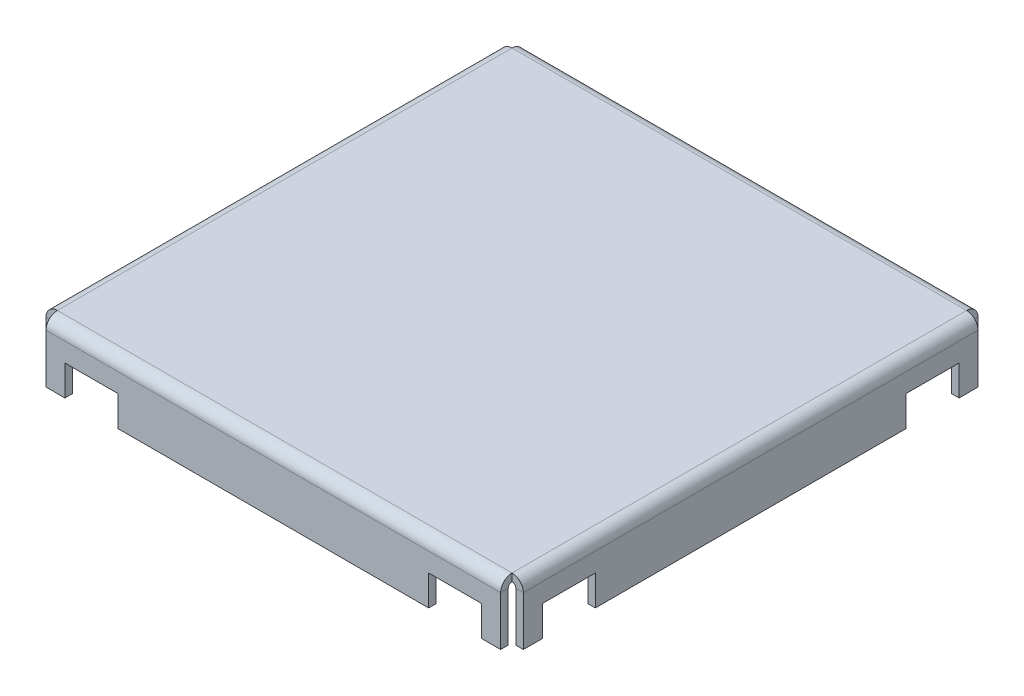
from build123d import *

# Parameters (mm, degrees)
BASES_W             = 12
BASES_H             = 12
BASE_DEPTH          = 0.2
EDGE_FLANGE1_DEPTH  = 12
EDGE_FLANGE2_DEPTH  = 12
EDGE_FLANGE3_DEPTH  = 12
EDGE_FLANGE4_DEPTH  = 12
VENTS_W             = 1.4
VENTS_H             = 0.8
VENT_DEPTH          = 10.052071586
VCP_COUNT           = 2
VCP_ANGLE           = 90
VCP_COPY_1_SKETCH_W = 1.4
VCP_COPY_1_SKETCH_H = 0.8
VCP_COPY_1_DEPTH    = 10.052071586


# Sheet-metal steps are written as plain solids
with BuildPart() as part:
    # BaseS → Base (new body)
    with BuildSketch(Plane(origin=(0, 1.6, 0), x_dir=(1, 0, 0), z_dir=(0, 1, 0))):
        Rectangle(BASES_W, BASES_H)
    extrude(amount=-BASE_DEPTH)

    # Edge-Flange1 section (across the edge) → Edge-Flange1 (add)
    with BuildSketch(Plane(origin=(6, 1.4, 6.1), x_dir=(0, 0, -1), z_dir=(-1, 0, 0))):
        with BuildLine():
            Line((-0.2, 0.1), (-0.2, 1.4))
            Line((-0.2, 1.4), (0, 1.4))
            Line((0, 1.4), (0, 0.1))
            ThreePointArc((0, 0.1), (0.029289322, 0.029289322), (0.1, 0))
            Line((0.1, 0), (0.1, -0.2))
            ThreePointArc((0.1, -0.2), (-0.112132034, -0.112132034), (-0.2, 0.1))
        make_face()
    extrude(amount=EDGE_FLANGE1_DEPTH)

    # Edge-Flange2 section (across the edge) → Edge-Flange2 (add)
    with BuildSketch(Plane(origin=(-6, 1.4, -6.1), x_dir=(0, 0, 1), z_dir=(1, 0, 0))):
        with BuildLine():
            Line((-0.2, 0.1), (-0.2, 1.4))
            Line((-0.2, 1.4), (0, 1.4))
            Line((0, 1.4), (0, 0.1))
            ThreePointArc((0, 0.1), (0.029289322, 0.029289322), (0.1, 0))
            Line((0.1, 0), (0.1, -0.2))
            ThreePointArc((0.1, -0.2), (-0.112132034, -0.112132034), (-0.2, 0.1))
        make_face()
    extrude(amount=EDGE_FLANGE2_DEPTH)

    # Edge-Flange3 section (across the edge) → Edge-Flange3 (add)
    with BuildSketch(Plane(origin=(6.1, 1.4, -6), x_dir=(-1, 0, 0), z_dir=(0, 0, 1))):
        with BuildLine():
            Line((-0.2, 0.1), (-0.2, 1.4))
            Line((-0.2, 1.4), (0, 1.4))
            Line((0, 1.4), (0, 0.1))
            ThreePointArc((0, 0.1), (0.029289322, 0.029289322), (0.1, 0))
            Line((0.1, 0), (0.1, -0.2))
            ThreePointArc((0.1, -0.2), (-0.112132034, -0.112132034), (-0.2, 0.1))
        make_face()
    extrude(amount=EDGE_FLANGE3_DEPTH)

    # Edge-Flange4 section (across the edge) → Edge-Flange4 (add)
    with BuildSketch(Plane(origin=(-6.1, 1.4, 6), x_dir=(1, 0, 0), z_dir=(0, 0, -1))):
        with BuildLine():
            Line((-0.2, 0.1), (-0.2, 1.4))
            Line((-0.2, 1.4), (0, 1.4))
            Line((0, 1.4), (0, 0.1))
            ThreePointArc((0, 0.1), (0.029289322, 0.029289322), (0.1, 0))
            Line((0.1, 0), (0.1, -0.2))
            ThreePointArc((0.1, -0.2), (-0.112132034, -0.112132034), (-0.2, 0.1))
        make_face()
    extrude(amount=EDGE_FLANGE4_DEPTH)

    # VentS → Vent (cut, symmetric)
    with BuildSketch(Plane(origin=(0, 0, 0), x_dir=(0, 0, -1), z_dir=(1, 0, 0))):
        with Locations((4.8, 0.4)):
            Rectangle(VENTS_W, VENTS_H)
    vent = extrude(amount=VENT_DEPTH, both=True, mode=Mode.SUBTRACT)

    # VHM: Vent across plane
    add(vent.mirror(Plane.XY), mode=Mode.SUBTRACT)

    # VCP: Vent ×2 about axis
    vcp_axis = Axis((0, 1.68, 0), (0, -1, 0))
    for i in range(1, VCP_COUNT):
        add(vent.rotate(vcp_axis, i * VCP_ANGLE / (VCP_COUNT - 1)), mode=Mode.SUBTRACT)

    # VCP copy 1 sketch → VCP copy 1 (cut, symmetric)
    with BuildSketch(Plane(origin=(0, 0, 0), x_dir=(-1, 0, 0), z_dir=(0, 0, 1))):
        with Locations((4.8, -0.4)):
            Rectangle(VCP_COPY_1_SKETCH_W, VCP_COPY_1_SKETCH_H)
    extrude(amount=VCP_COPY_1_DEPTH, both=True, mode=Mode.SUBTRACT)


solid = part.part
